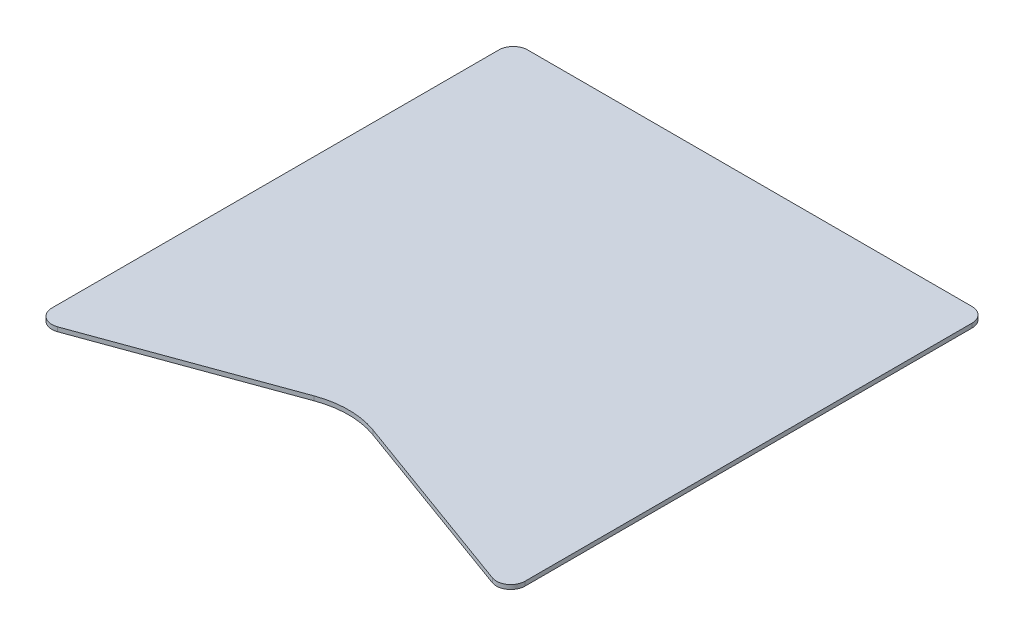
from build123d import *

# Parameters (mm, degrees)
BOSS_EXTRUDE1_DEPTH = 3
SKETCH5_W           = 90
SKETCH5_H           = 150
CUT_EXTRUDE3_DEPTH  = 535.143239216
SKETCH6_W           = 330
SKETCH6_H           = 70
CUT_EXTRUDE4_DEPTH  = 467.700117849
FILLET1_R           = 10


with BuildPart() as part:
    # Sketch3 → Boss-Extrude1 (new body)
    with BuildSketch(Plane(origin=(0, 0, 0), x_dir=(1, 0, 0), z_dir=(0, 1, 0))):
        with BuildLine():
            Line((0, 330), (0, 32.379717841))
            ThreePointArc((0, 32.379717841), (-3.847681031, 19.053825667), (-14.206352179, 9.829836096))
            Line((-14.206352179, 9.829836096), (-67.269835876, -15.569344958))
            ThreePointArc((-67.269835876, -15.569344958), (-86.877445819, -67.142831858), (-36.319194267, -89.236860887))
            Line((-36.319194267, -89.236860887), (144.478790315, -23.431776084))
            ThreePointArc((144.478790315, -23.431776084), (165.000000077, -19.813332936), (185.52120983, -23.431776136))
            Line((185.52120983, -23.431776136), (366.319192052, -89.236860081))
            ThreePointArc((366.319192052, -89.236860081), (416.877444894, -67.142834059), (397.269838057, -15.569346002))
            Line((397.269838057, -15.569346002), (344.206351456, 9.829836443))
            ThreePointArc((344.206351456, 9.829836443), (333.847680817, 19.053826006), (330, 32.379717841))
            Line((330, 32.379717841), (330, 330))
            Line((330, 330), (0, 330))
        make_face()
    extrude(amount=BOSS_EXTRUDE1_DEPTH)

    # Sketch5 → Cut-Extrude3 (cut, through all)
    with BuildSketch(Plane(origin=(0, 0, 0), x_dir=(1, 0, 0), z_dir=(0, 1, 0))):
        with Locations((375, -16.649156055)):
            Rectangle(SKETCH5_W, SKETCH5_H)
        with Locations((-45, -16.649156055)):
            Rectangle(SKETCH5_W, SKETCH5_H)
    extrude(amount=CUT_EXTRUDE3_DEPTH, mode=Mode.SUBTRACT)

    # Sketch6 → Cut-Extrude4 (cut, through all)
    with BuildSketch(Plane(origin=(0, 3, 0), x_dir=(1, 0, 0), z_dir=(0, 1, 0))):
        with Locations((165, 295)):
            Rectangle(SKETCH6_W, SKETCH6_H)
    extrude(amount=-CUT_EXTRUDE4_DEPTH, mode=Mode.SUBTRACT)

    # Fillet1
    fillet1_edges = [part.edges().sort_by_distance(p)[0] for p in [
        (330, 1.5, 76.017755241),
        (0, 1.5, 76.017755241),
        (330, 1.5, -260),
        (0, 1.5, -260),
    ]]
    fillet(fillet1_edges, radius=FILLET1_R)


solid = part.part
